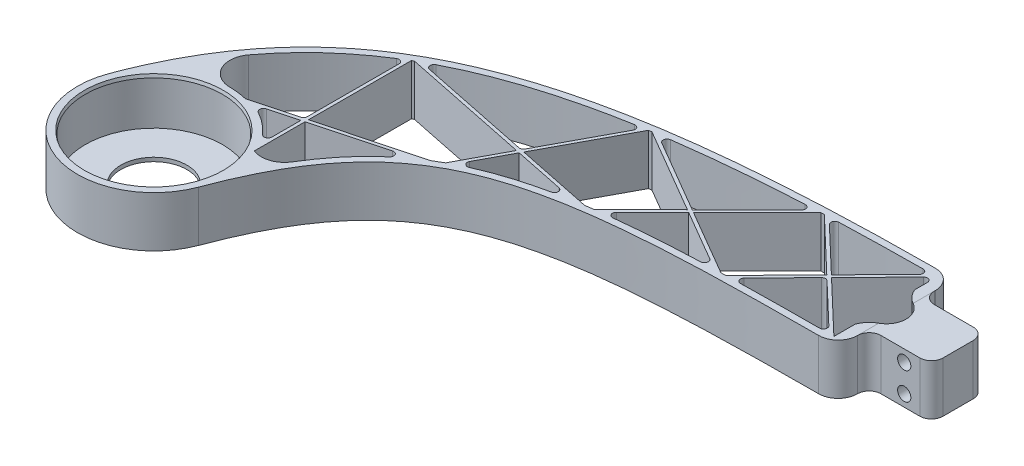
from build123d import *

# Parameters (mm, degrees)
SKETCH1_R               = 19.65
SKETCH1_R_2             = 17.65
BOSS_EXTRUDE1_DEPTH     = 6.5
BOSS_EXTRUDE2_START     = -6.5
BOSS_EXTRUDE2_DEPTH     = 13
CUT_EXTRUDE1_DEPTH      = 168.960911721
CUT_EXTRUDE1_DEPTH_BACK = 168.960911721
EXTRUDE_THIN1_START     = -6.5
EXTRUDE_THIN1_DEPTH     = 13
FILLET1_R               = 3
FILLET2_R               = 3
FILLET4_R               = 6
CUT_EXTRUDE3_DEPTH      = 173.638997303
CUT_EXTRUDE3_DEPTH_BACK = 173.638997303
SKETCH8_R               = 1.7
FILLET9_R               = 1
CUT_EXTRUDE7_DEPTH      = 169.079454596
CUT_EXTRUDE7_DEPTH_BACK = 169.079454596
FILLET11_R              = 5
CUT_EXTRUDE4_DEPTH      = 168.955577145
CUT_EXTRUDE4_DEPTH_BACK = 168.955577145
SKETCH17_R              = 18
BOSS_EXTRUDE5_DEPTH     = 1
CHAMFER10_SIZE          = 0.8
CHAMFER10_SIZE2         = 0.214359354
SKETCH21_R              = 8.5
CUT_EXTRUDE8_DEPTH      = 10


# Read off the part's stored shape, not the designer's step: Boss-Extrude2, Extrude-Thin1
with BuildPart() as part:
    # Sketch1 → Boss-Extrude1 (new, symmetric)
    with BuildSketch(Plane(origin=(0, 0, 0), x_dir=(1, 0, 0), z_dir=(0, 1, 0))):
        with Locations(Location((0, 0, 0), (0, 0, 90))):
            Circle(SKETCH1_R)
        with Locations(Location((0, 0, 0), (0, 0, 90))):
            Circle(SKETCH1_R_2, mode=Mode.SUBTRACT)
    extrude(amount=BOSS_EXTRUDE1_DEPTH, both=True)

    # Boss-Extrude2 outline → Boss-Extrude2 (add)
    with BuildSketch(Plane(origin=(0, 0, 0), x_dir=(1, 0, 0), z_dir=(0, 1, 0)).offset(BOSS_EXTRUDE2_START)):
        with BuildLine():
            Line((136.209752799, 61.554461052), (136.209752799, 69.814461052))
            add(Edge.make_bspline(
                [(136.209752799, 69.814461052), (45.48880182, 69.814461052), (0.542337594, 57.601832997), (-18.407462693, 6.876613788)],
                knots=[0, 0, 0, 0, 1, 1, 1, 1], degree=3))
            ThreePointArc((-18.407462693, 6.876613788), (6.876613788, 18.407462693), (18.407462693, -6.876613788))
            add(Edge.make_bspline(
                [(18.407462693, -6.876613788), (34.669750075, 36.654615026), (59.935333499, 39.814461052), (136.209752799, 39.814461052)],
                knots=[0, 0, 0, 0, 1, 1, 1, 1], degree=3))
            Line((136.209752799, 39.814461052), (136.209752799, 47.814461052))
            Line((136.209752799, 47.814461052), (152.209752799, 47.814461052))
            Line((152.209752799, 47.814461052), (152.209752799, 61.554461052))
            Line((152.209752799, 61.554461052), (136.209752799, 61.554461052))
        make_face()
    extrude(amount=BOSS_EXTRUDE2_DEPTH)

    # Sketch3 → Cut-Extrude1 (cut, two sides: drawn at the far end of the back side and taken through both)
    with BuildSketch(Plane(origin=(0, 6.5, 0), x_dir=(1, 0, 0), z_dir=(0, 1, 0)).offset(-CUT_EXTRUDE1_DEPTH_BACK)):
        with BuildLine():
            add(Edge.make_bspline(
                [(-13.647671687, 13.773639952), (-13.564326537, 13.953165074), (-13.343091261, 14.425928358), (-12.44058388, 16.314581323), (-10.876828142, 19.347584816), (-7.830800547, 24.566417764), (-3.622687381, 30.572209939), (2.099308988, 37.000410973), (8.529414985, 42.698111447), (18.098858051, 49.380864617), (32.028227306, 56.122252664), (48.817283445, 60.948007409), (64.082150206, 63.794217753), (76.474853669, 65.457132948), (89.838926474, 66.684295524), (101.807324628, 67.374492909), (111.895362427, 67.745872365), (119.719618665, 67.93873332), (126.464151957, 68.03199632), (131.002716589, 68.062028358), (133.005597096, 68.069417805), (133.610658066, 68.071078485), (133.809752799, 68.071563008)],
                knots=[0.052180259, 0.052180259, 0.052180259, 0.052180259, 0.056086509, 0.0625, 0.09375, 0.125, 0.1875, 0.25, 0.3125, 0.375, 0.5, 0.625, 0.6875, 0.75, 0.8125, 0.875, 0.90625, 0.9375, 0.96875, 0.984375, 0.988908142, 0.991126514, 0.991126514, 0.991126514, 0.991126514], degree=3))
            Line((133.809752799, 68.071563008), (133.809752799, 41.553360303))
            add(Edge.make_bspline(
                [(19.388992025, 0.197707471), (19.457631145, 0.354446846), (19.656359895, 0.805387345), (20.411713061, 2.488236956), (21.686153085, 5.151767666), (24.076391192, 9.637552716), (27.291490569, 14.733919766), (31.580623424, 20.077792026), (36.36058971, 24.687756239), (43.455486145, 29.906429748), (53.780589932, 34.795077489), (66.360389163, 37.889559637), (78.020655082, 39.54052087), (87.629906573, 40.425198857), (98.16866238, 41.014224649), (107.77967111, 41.305624795), (115.998870044, 41.446832562), (122.434473297, 41.513662896), (128.022091146, 41.542438482), (131.661773587, 41.550688788), (133.214759272, 41.552749438), (133.611155485, 41.553173189), (133.809752799, 41.553360303)],
                knots=[0.051220581, 0.051220581, 0.051220581, 0.051220581, 0.055126831, 0.0625, 0.09375, 0.125, 0.1875, 0.25, 0.3125, 0.375, 0.5, 0.625, 0.6875, 0.75, 0.8125, 0.875, 0.90625, 0.9375, 0.96875, 0.984166635, 0.986805529, 0.989444423, 0.989444423, 0.989444423, 0.989444423], degree=3))
            ThreePointArc((19.388992025, 0.197707471), (7.37001869, 17.934740715), (-13.647671687, 13.773639952))
        make_face()
    extrude(amount=CUT_EXTRUDE1_DEPTH + CUT_EXTRUDE1_DEPTH_BACK, mode=Mode.SUBTRACT)

    # Extrude-Thin1 outline → Extrude-Thin1 (add)
    # profile 1 of 6: a face of its own
    with BuildSketch(Plane(origin=(0, 0, 0), x_dir=(1, 0, 0), z_dir=(0, 1, 0)).offset(EXTRUDE_THIN1_START)):
        with BuildLine():
            Line((17.533855825, 21.353374137), (40.126041231, 27.390450677))
            add(Edge.make_bspline(
                [(40.126041231, 27.390450677), (40.668417575, 27.767768951), (41.407255627, 28.260500521), (42.161719288, 28.735694579), (42.354673689, 28.855458718)],
                knots=[0.356306189, 0.356306189, 0.356306189, 0.356306189, 0.375, 0.381378328, 0.381378328, 0.381378328, 0.381378328], degree=3))
            Line((42.354673689, 28.855458718), (17.535200521, 22.223207057))
            Line((17.535200521, 22.223207057), (17.576055013, 48.650428157))
            add(Edge.make_bspline(
                [(16.735281745, 48.1508797), (17.013967506, 48.318664201), (17.294222705, 48.485177824), (17.576055013, 48.650428157)],
                knots=[0.382365166, 0.382365166, 0.382365166, 0.382365166, 0.38918359, 0.38918359, 0.38918359, 0.38918359], degree=3))
            Line((16.735281745, 48.1508797), (16.694852368, 21.998649493))
            Line((16.694852368, 21.998649493), (4.735450021, 18.802861833))
            ThreePointArc((4.735450021, 18.802861833), (12.297262487, 14.991645518), (17.513709041, 8.321183547))
            Line((17.513709041, 8.321183547), (17.533855825, 21.353374137))
        make_face()
        with BuildLine():
            ThreePointArc((16.677371876, 10.691181755), (12.466752517, 15.395329866), (6.989929893, 18.53582963))
            Line((6.989929893, 18.53582963), (16.693507672, 21.128816573))
            Line((16.693507672, 21.128816573), (16.677371876, 10.691181755))
        make_face(mode=Mode.SUBTRACT)
    # profile 2 of 6: a face of its own
    with BuildSketch(Plane(origin=(0, 0, 0), x_dir=(1, 0, 0), z_dir=(0, 1, 0)).offset(EXTRUDE_THIN1_START)):
        with BuildLine():
            Line((51.141297023, 42.146759095), (44.77744823, 30.271137406))
            add(Edge.make_bspline(
                [(44.77744823, 30.271137406), (45.216720465, 30.512578413), (45.661002648, 30.748870603), (46.110380937, 30.980120167)],
                knots=[0.407502507, 0.407502507, 0.407502507, 0.407502507, 0.421411077, 0.421411077, 0.421411077, 0.421411077], degree=3))
            Line((46.110380937, 30.980120167), (51.9997069, 41.970231562))
            Line((51.9997069, 41.970231562), (69.823858597, 38.304787338))
            add(Edge.make_bspline(
                [(69.823858597, 38.304787338), (70.593232068, 38.435433241), (71.372725295, 38.560910008), (72.162567085, 38.681421878)],
                knots=[0.628103115, 0.628103115, 0.628103115, 0.628103115, 0.6453057, 0.6453057, 0.6453057, 0.6453057], degree=3))
            Line((72.162567085, 38.681421878), (52.413645414, 42.74268505))
            Line((52.413645414, 42.74268505), (63.597191788, 63.612377306))
            add(Edge.make_bspline(
                [(62.55207803, 63.440495451), (62.899224884, 63.498408442), (63.247595093, 63.555701035), (63.597191788, 63.612377306)],
                knots=[0.678602818, 0.678602818, 0.678602818, 0.678602818, 0.684125212, 0.684125212, 0.684125212, 0.684125212], degree=3))
            Line((62.55207803, 63.440495451), (51.555235538, 42.919212583))
            Line((51.555235538, 42.919212583), (19.192096231, 49.574524098))
            add(Edge.make_bspline(
                [(18.082614058, 48.94510555), (18.449786881, 49.157014433), (18.819608731, 49.366815133), (19.192096231, 49.574524098)],
                knots=[0.393255066, 0.393255066, 0.393255066, 0.393255066, 0.402079093, 0.402079093, 0.402079093, 0.402079093], degree=3))
            Line((18.082614058, 48.94510555), (51.141297023, 42.146759095))
        make_face()
    # profile 3 of 6: a face of its own
    with BuildSketch(Plane(origin=(0, 0, 0), x_dir=(1, 0, 0), z_dir=(0, 1, 0)).offset(EXTRUDE_THIN1_START)):
        with BuildLine():
            Line((86.325558696, 50.929834803), (74.301305282, 38.992241007))
            add(Edge.make_bspline(
                [(74.301305282, 38.992241007), (74.757364987, 39.055315253), (75.216782527, 39.116867659), (75.679598971, 39.176934886)],
                knots=[0.660652231, 0.660652231, 0.660652231, 0.660652231, 0.670356032, 0.670356032, 0.670356032, 0.670356032], degree=3))
            Line((75.679598971, 39.176934886), (87.07644839, 50.491646431))
            Line((87.07644839, 50.491646431), (103.081425919, 41.151799163))
            add(Edge.make_bspline(
                [(103.081425919, 41.151799163), (103.605636943, 41.168871811), (104.133056122, 41.185266985), (104.66371201, 41.201008585)],
                knots=[0.838877493, 0.838877493, 0.838877493, 0.838877493, 0.847453054, 0.847453054, 0.847453054, 0.847453054], degree=3))
            Line((104.66371201, 41.201008585), (87.693421418, 51.104172892))
            Line((87.693421418, 51.104172892), (104.150434518, 67.442579171))
            add(Edge.make_bspline(
                [(102.901443978, 67.386256546), (103.316560743, 67.405462085), (103.732889971, 67.42423505), (104.150434518, 67.442579171)],
                knots=[0.868799687, 0.868799687, 0.868799687, 0.868799687, 0.874068133, 0.874068133, 0.874068133, 0.874068133], degree=3))
            Line((102.901443978, 67.386256546), (86.942531724, 51.542361264))
            Line((86.942531724, 51.542361264), (65.693230449, 63.942580388))
            add(Edge.make_bspline(
                [(64.377884172, 63.73759586), (64.814434643, 63.806867805), (65.252881395, 63.875193337), (65.693230449, 63.942580388)],
                knots=[0.688225253, 0.688225253, 0.688225253, 0.688225253, 0.695085438, 0.695085438, 0.695085438, 0.695085438], degree=3))
            Line((64.377884172, 63.73759586), (86.325558696, 50.929834803))
        make_face()
    # profile 4 of 6: a face of its own
    with BuildSketch(Plane(origin=(0, 0, 0), x_dir=(1, 0, 0), z_dir=(0, 1, 0)).offset(EXTRUDE_THIN1_START)):
        with BuildLine():
            Line((118.764006063, 54.339630858), (105.907324113, 41.23655112))
            add(Edge.make_bspline(
                [(105.907324113, 41.23655112), (106.30824727, 41.247582379), (106.710995758, 41.258257978), (107.115581548, 41.268587937)],
                knots=[0.854120415, 0.854120415, 0.854120415, 0.854120415, 0.860538376, 0.860538376, 0.860538376, 0.860538376], degree=3))
            Line((107.115581548, 41.268587937), (119.371595699, 53.759488105))
            Line((119.371595699, 53.759488105), (132.157457303, 41.551207201))
            add(Edge.make_bspline(
                [(132.157457303, 41.551207201), (132.311734919, 41.551466075), (132.663479429, 41.552017947), (133.069097295, 41.55255616), (133.319632504, 41.552847733), (133.372042221, 41.552906947)],
                knots=[0.982098304, 0.982098304, 0.982098304, 0.982098304, 0.984166635, 0.986805529, 0.987503394, 0.987503394, 0.987503394, 0.987503394], degree=3))
            Line((133.372042221, 41.552906947), (119.959955733, 54.359124035))
            Line((119.959955733, 54.359124035), (133.387440816, 68.043946325))
            Line((133.387440816, 68.043946325), (133.390576654, 41.552927814))
            add(Edge.make_bspline(
                [(133.390576654, 41.552927814), (133.530177668, 41.553084422), (133.669866202, 41.553228505), (133.809752799, 41.553360303)],
                knots=[0.987585657, 0.987585657, 0.987585657, 0.987585657, 0.989444423, 0.989444423, 0.989444423, 0.989444423], degree=3))
            Line((133.809752799, 41.553360303), (133.809752799, 68.071563008))
            add(Edge.make_bspline(
                [(132.23267518, 68.066426472), (132.558955653, 68.067760234), (133.084525043, 68.069634434), (133.610658066, 68.071078485), (133.809752799, 68.071563008)],
                knots=[0.98525571, 0.98525571, 0.98525571, 0.98525571, 0.988908142, 0.991126514, 0.991126514, 0.991126514, 0.991126514], degree=3))
            Line((132.23267518, 68.066426472), (119.352366097, 54.939266788))
            Line((119.352366097, 54.939266788), (106.168538603, 67.527536114))
            add(Edge.make_bspline(
                [(105.002635801, 67.479353387), (105.39022978, 67.495777746), (105.778863717, 67.511837663), (106.168538603, 67.527536114)],
                knots=[0.87764533, 0.87764533, 0.87764533, 0.87764533, 0.882516605, 0.882516605, 0.882516605, 0.882516605], degree=3))
            Line((105.002635801, 67.479353387), (118.764006063, 54.339630858))
        make_face()
    # profile 5 of 6: a face of its own
    with BuildSketch(Plane(origin=(0, 0, 0), x_dir=(1, 0, 0), z_dir=(0, 1, 0)).offset(EXTRUDE_THIN1_START)):
        with BuildLine():
            Line((134.227197537, 70.099173769), (133.945314011, 69.811887956))
            add(Edge.make_bspline(
                [(134.227231472, 69.812492312), (134.133209251, 69.812304392), (134.039236772, 69.812102951), (133.945314011, 69.811887956)],
                knots=[0.007311263, 0.007311263, 0.007311263, 0.007311263, 0.008355343, 0.008355343, 0.008355343, 0.008355343], degree=3))
            Line((134.227231472, 69.812492312), (134.227197537, 70.099173769))
        make_face()
    # profile 6 of 6: a face of its own
    with BuildSketch(Plane(origin=(0, 0, 0), x_dir=(1, 0, 0), z_dir=(0, 1, 0)).offset(EXTRUDE_THIN1_START)):
        with BuildLine():
            Line((133.977364241, 39.813511626), (134.230811207, 39.571513719))
            Line((134.230811207, 39.571513719), (134.230782536, 39.813719224))
            add(Edge.make_bspline(
                [(133.977364241, 39.813511626), (134.061773369, 39.813585241), (134.146246114, 39.813654422), (134.230782536, 39.813719224)],
                knots=[0.990179729, 0.990179729, 0.990179729, 0.990179729, 0.991301049, 0.991301049, 0.991301049, 0.991301049], degree=3))
        make_face()
    extrude(amount=EXTRUDE_THIN1_DEPTH)

    # Fillet1
    fillet1_edges = [part.edges().sort_by_distance(p)[0] for p in [
        (136.209752799, 0, -47.814461052),
        (136.209752799, 0, -61.554461052),
    ]]
    fillet(fillet1_edges, radius=FILLET1_R)

    # Fillet2
    fillet2_edges = [part.edges().sort_by_distance(p)[0] for p in [
        (152.209752799, 0, -47.814461052),
        (152.209752799, 0, -61.554461052),
    ]]
    fillet(fillet2_edges, radius=FILLET2_R)

    # Fillet4
    # the kernel refuses this fillet: 6 mm, written as the material it adds along each edge
    with BuildSketch(Plane(origin=(19.388992025, 6.5, -0.197707471), x_dir=(-0.22493178158206856, 0, -0.974374514052126), z_dir=(0, -1, 0))) as fillet4_piece_1:
        with BuildLine():
            CenterArc((13.278425042, 3.403453039), FILLET4_R, 134.439052647, 80.119084488)
            Line((9.077524079, 7.68742679), (8.99350606, 7.773106265))
            ThreePointArc((8.99350606, 7.773106265), (4.59142273, 3.781216357), (-0.07162831, 0.096277647))
            Line((-0.07162831, 0.096277647), (0.025798202, -0.117194082))
            ThreePointArc((0.025798202, -0.117194082), (4.168559398, 0.333389624), (8.238292672, -0.068069061))
            Line((8.238292672, -0.068069061), (8.337118797, 0))
        make_face()
    extrude(amount=13)
    with BuildSketch(Plane(origin=(-13.647671687, 6.5, -13.773639952), x_dir=(0.9260253757885925, 0, -0.37746126078790676), z_dir=(0, -1, 0))) as fillet4_piece_2:
        with BuildLine():
            CenterArc((17.180080948, -5.540858424), FILLET4_R, 112.56028029, 126.531715849)
            Line((14.098114268, -10.688817377), (14.036474934, -10.791776556))
            ThreePointArc((14.036474934, -10.791776556), (6.694504836, -5.809858329), (-0.081717549, -0.087876289))
            Line((-0.081717549, -0.087876289), (0.046038627, 0.110817168))
            ThreePointArc((0.046038627, 0.110817168), (7.439074801, -1.363792526), (14.832110974, 0.110817168))
            Line((14.832110974, 0.110817168), (14.878149601, 0))
        make_face()
    extrude(amount=13)

    # Sketch8 → Cut-Extrude3 (cut, two sides: drawn at the far end of the back side and taken through both)
    with BuildSketch(Plane(origin=(0, 0, -61.554461052), x_dir=(-1, 0, 0), z_dir=(0, 0, -1)).offset(-CUT_EXTRUDE3_DEPTH_BACK)):
        with Locations((-145.209752799, 3.5)):
            Circle(SKETCH8_R)
        with Locations((-145.209752799, -3.5)):
            Circle(SKETCH8_R)
    extrude(amount=CUT_EXTRUDE3_DEPTH + CUT_EXTRUDE3_DEPTH_BACK, mode=Mode.SUBTRACT)

    # Fillet9
    fillet9_edges = [part.edges().sort_by_distance(p)[0] for p in [
        (62.55207803, 0, -63.440495451),
        (102.901443978, 0, -67.386256546),
        (46.110380937, 0, -30.980120167),
        (119.371595699, 0, -53.759488105),
        (103.081425919, 0, -41.151799163),
        (107.115581548, 0, -41.268587937),
        (75.679598971, 0, -39.176934886),
        (69.823858597, 0, -38.304787338),
        (40.126041231, 0, -27.390450677),
        (16.694852368, 0, -21.998649493),
        (6.989929893, 0, -18.53582963),
        (16.677371876, 0, -10.691181755),
        (19.192096231, 0, -49.574524098),
        (16.735281745, 0, -48.1508797),
        (51.555235538, 0, -42.919212583),
        (132.23267518, 0, -68.066426472),
        (132.157457303, 0, -41.551207201),
        (65.693230449, 0, -63.942580388),
        (106.168538603, 0, -67.527536114),
        (133.387440816, 0, -68.043946325),
    ]]
    fillet(fillet9_edges, radius=FILLET9_R)

    # Sketch20 → Cut-Extrude7 (cut, two sides: drawn at the far end of the back side and taken through both)
    with BuildSketch(Plane.XZ.offset(6.5).offset(-CUT_EXTRUDE7_DEPTH_BACK)):
        with BuildLine():
            Line((136.209752799, -39.814461052), (138.167567055, -36.322830933))
            Line((138.167567055, -36.322830933), (132.911085666, -39.812337512))
            add(Edge.make_bspline(
                [(132.911085666, -39.812337512), (133.999918769, -39.813791467), (135.099431289, -39.814461052), (136.209752799, -39.814461052)],
                knots=[0.985443068, 0.985443068, 0.985443068, 0.985443068, 1, 1, 1, 1], degree=3))
        make_face()
        with BuildLine():
            Line((136.209752799, -69.814461052), (134.128473583, -71.895740268))
            Line((134.128473583, -71.895740268), (132.038355307, -69.805621993))
            add(Edge.make_bspline(
                [(132.038355307, -69.805621993), (133.417947538, -69.811547011), (134.808389069, -69.814461052), (136.209752799, -69.814461052)],
                knots=[0.984553031, 0.984553031, 0.984553031, 0.984553031, 1, 1, 1, 1], degree=3))
        make_face()
    extrude(amount=CUT_EXTRUDE7_DEPTH + CUT_EXTRUDE7_DEPTH_BACK, mode=Mode.SUBTRACT)

    # Fillet11
    fillet11_edges = [part.edges().sort_by_distance(p)[0] for p in [
        (136.209752799, 0, -69.814461052),
        (136.209752799, 0, -39.814461052),
    ]]
    fillet(fillet11_edges, radius=FILLET11_R)

    # Sketch10 → Cut-Extrude4 (cut, two sides: drawn at the far end of the back side and taken through both)
    with BuildSketch(Plane(origin=(0, 6.5, 0), x_dir=(1, 0, 0), z_dir=(0, 1, 0)).offset(-CUT_EXTRUDE4_DEPTH_BACK)):
        with BuildLine():
            Line((132.989752799, 44.814461052), (132.989752799, 64.554461052))
            ThreePointArc((132.989752799, 64.554461052), (133.854923203, 61.389938971), (136.209752799, 59.105754784))
            ThreePointArc((136.209752799, 59.105754784), (138.82258695, 54.684461052), (136.209752799, 50.263167321))
            ThreePointArc((136.209752799, 50.263167321), (133.854923203, 47.978983133), (132.989752799, 44.814461052))
        make_face()
    extrude(amount=CUT_EXTRUDE4_DEPTH + CUT_EXTRUDE4_DEPTH_BACK, mode=Mode.SUBTRACT)

    # Sketch17 → Boss-Extrude5 (add)
    with BuildSketch(Plane.XZ.offset(6.5)):
        Circle(SKETCH17_R)
    extrude(amount=-BOSS_EXTRUDE5_DEPTH)

    # Chamfer10
    chamfer10_edges = [part.edges().sort_by_distance(p)[0] for p in [
        (0, 6.5, 17.65),
    ]]
    chamfer10_side = [part.faces().sort_by_distance(p)[0] for p in [
        (0, 0.5, 17.65),
    ]]
    chamfer(chamfer10_edges, length=CHAMFER10_SIZE, length2=CHAMFER10_SIZE2, reference=chamfer10_side[0])

    # Sketch21 → Cut-Extrude8 (cut)
    with BuildSketch(Plane(origin=(0, -5.5, 0), x_dir=(1, 0, 0), z_dir=(0, 1, 0))):
        with Locations(Location((0, 0, 0), (0, 0, 270))):
            Circle(SKETCH21_R)
    extrude(amount=-CUT_EXTRUDE8_DEPTH, mode=Mode.SUBTRACT)


solid = part.part
